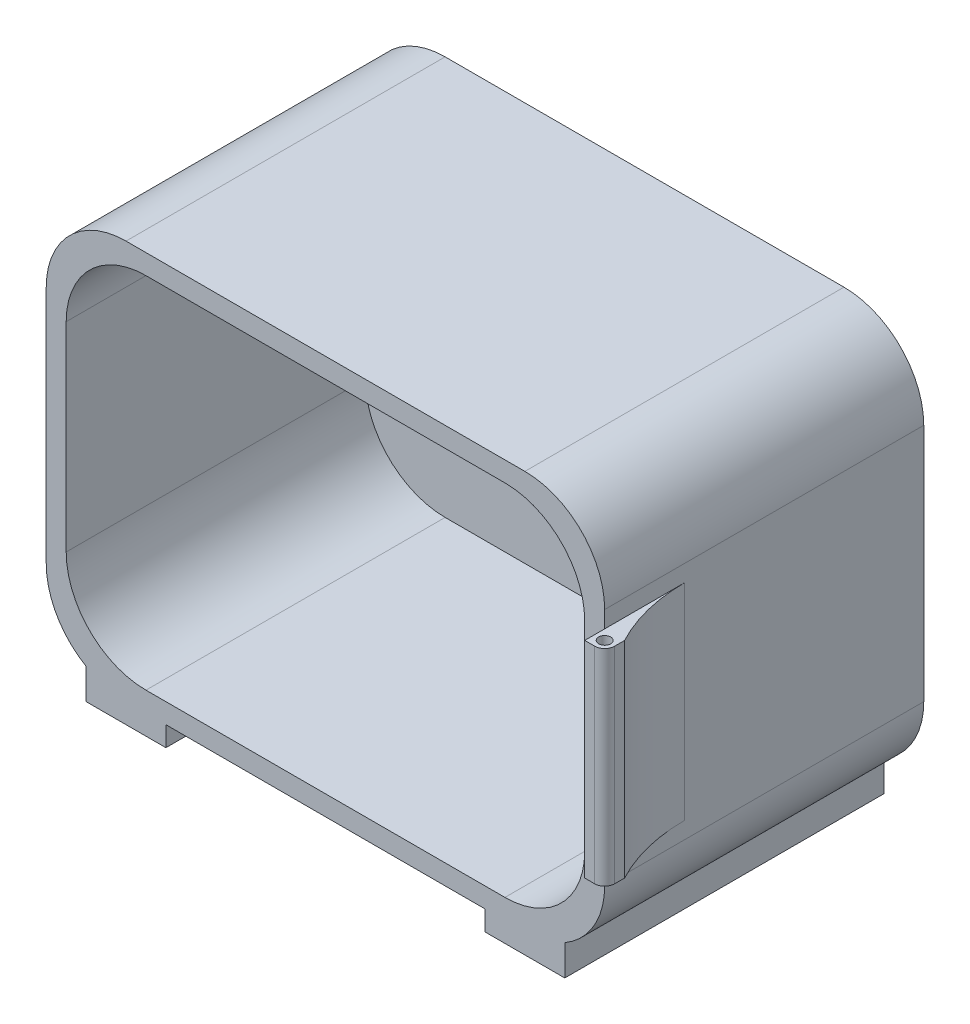
from build123d import *

# Parameters (mm, degrees)
BOSS_EXTRUDE1_DEPTH             = 95.25
BOSS_EXTRUDE2_DEPTH             = 6.35
SKETCH4_W                       = 25.4
SKETCH4_H                       = 101.6
BOSS_EXTRUDE3_DEPTH             = 6.35
BOSS_EXTRUDE3_DIRECTION_2_REACH = 187.35
BOSS_EXTRUDE5_DEPTH             = 32.766
BOSS_EXTRUDE5_DEPTH_BACK        = 32.766
SKETCH5_R                       = 1.905
FILLET1_R                       = 3.175


with BuildPart() as part:
    # Sketch1 → Boss-Extrude1 (new body)
    with BuildSketch(Plane.XY):
        with BuildLine():
            Line((-63.5, 63.5), (63.5, 63.5))
            ThreePointArc((63.5, 63.5), (81.460512242, 56.060512242), (88.9, 38.1))
            Line((88.9, 38.1), (88.9, -38.1))
            ThreePointArc((88.9, -38.1), (81.460512242, -56.060512242), (63.5, -63.5))
            Line((63.5, -63.5), (-63.5, -63.5))
            ThreePointArc((-63.5, -63.5), (-81.460512242, -56.060512242), (-88.9, -38.1))
            Line((-88.9, -38.1), (-88.9, 38.1))
            ThreePointArc((-88.9, 38.1), (-81.460512242, 56.060512242), (-63.5, 63.5))
        make_face()
        with BuildLine():
            Line((-82.55, 31.75), (-82.55, -31.75))
            ThreePointArc((-82.55, -31.75), (-75.110512242, -49.710512242), (-57.15, -57.15))
            Line((-57.15, -57.15), (57.15, -57.15))
            ThreePointArc((57.15, -57.15), (75.110512242, -49.710512242), (82.55, -31.75))
            Line((82.55, -31.75), (82.55, 31.75))
            ThreePointArc((82.55, 31.75), (75.110512242, 49.710512242), (57.15, 57.15))
            Line((57.15, 57.15), (-57.15, 57.15))
            ThreePointArc((-57.15, 57.15), (-75.110512242, 49.710512242), (-82.55, 31.75))
        make_face(mode=Mode.SUBTRACT)
    extrude(amount=-BOSS_EXTRUDE1_DEPTH)

    # Sketch2 → Boss-Extrude2 (add)
    with BuildSketch(Plane(origin=(0, 0, -95.25), x_dir=(-1, 0, 0), z_dir=(0, 0, -1))):
        with BuildLine():
            Line((-63.5, 63.5), (63.5, 63.5))
            ThreePointArc((63.5, 63.5), (81.460512242, 56.060512242), (88.9, 38.1))
            Line((88.9, 38.1), (88.9, -38.1))
            ThreePointArc((88.9, -38.1), (81.460512242, -56.060512242), (63.5, -63.5))
            Line((63.5, -63.5), (-63.5, -63.5))
            ThreePointArc((-63.5, -63.5), (-81.460512242, -56.060512242), (-88.9, -38.1))
            Line((-88.9, -38.1), (-88.9, 38.1))
            ThreePointArc((-88.9, 38.1), (-81.460512242, 56.060512242), (-63.5, 63.5))
        make_face()
    extrude(amount=BOSS_EXTRUDE2_DEPTH)

    # Sketch4 → Boss-Extrude3 (add)
    with BuildSketch(Plane.XZ.offset(63.5)):
        with Locations((-63.5, -50.8)):
            Rectangle(SKETCH4_W, SKETCH4_H)
        with Locations((63.5, -50.8)):
            Rectangle(SKETCH4_W, SKETCH4_H)
    extrude(amount=BOSS_EXTRUDE3_DEPTH)

    # Sketch4 → Boss-Extrude3 direction 2 (add, up to next)
    with BuildSketch(Plane.XZ.offset(63.5), mode=Mode.PRIVATE) as boss_extrude3_direction_2_sk1:
        with Locations((-63.5, -50.8)):
            Rectangle(SKETCH4_W, SKETCH4_H)
    boss_extrude3_direction_2_tool1 = extrude(boss_extrude3_direction_2_sk1.sketch, amount=-BOSS_EXTRUDE3_DIRECTION_2_REACH, mode=Mode.PRIVATE) - part.part
    # Sketch4 → Boss-Extrude3 direction 2 (add, up to next)
    with BuildSketch(Plane.XZ.offset(63.5), mode=Mode.PRIVATE) as boss_extrude3_direction_2_sk2:
        with Locations((63.5, -50.8)):
            Rectangle(SKETCH4_W, SKETCH4_H)
    boss_extrude3_direction_2_tool2 = extrude(boss_extrude3_direction_2_sk2.sketch, amount=-BOSS_EXTRUDE3_DIRECTION_2_REACH, mode=Mode.PRIVATE) - part.part
    add(boss_extrude3_direction_2_tool1.solids().sort_by_distance((-63.5, -63.5, -50.8))[0])
    add(boss_extrude3_direction_2_tool2.solids().sort_by_distance((63.5, -63.5, -50.8))[0])

    # Sketch5 → Boss-Extrude5 (add, two sides: drawn at the far end of the back side and taken through both)
    with BuildSketch(Plane(origin=(0, 0, 0), x_dir=(1, 0, 0), z_dir=(0, 1, 0)).offset(-BOSS_EXTRUDE5_DEPTH_BACK)):
        with BuildLine():
            ThreePointArc((95.25, 0), (90.511558555, 12.309139639), (88.9, 25.4))
            Line((88.9, 25.4), (88.9, 0))
            Line((88.9, 0), (88.9, -6.35))
            Line((88.9, -6.35), (95.25, -6.35))
            Line((95.25, -6.35), (95.25, 0))
        make_face()
        with Locations((92.075, -3.175)):
            Circle(SKETCH5_R, mode=Mode.SUBTRACT)
    extrude(amount=BOSS_EXTRUDE5_DEPTH + BOSS_EXTRUDE5_DEPTH_BACK)

    # Fillet1
    fillet1_edges = [part.edges().sort_by_distance(p)[0] for p in [
        (95.25, 0, 6.35),
    ]]
    fillet(fillet1_edges, radius=FILLET1_R)


solid = part.part
